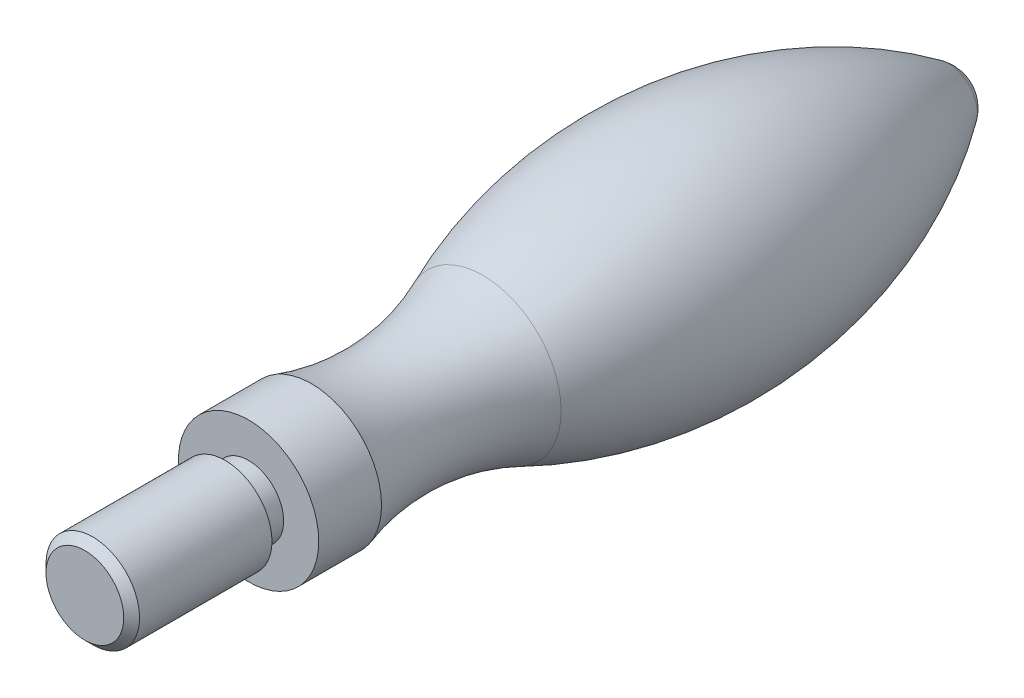
from build123d import *

# Parameters (mm, degrees)
SKETCH_1_R          = 4
EXTRUDE_1_DEPTH     = 14
SKETCH_2_OUTSIDE_W  = 13.6
SKETCH_2_OUTSIDE_H  = 13.6
SKETCH_2_OUTSIDE_R  = 3
CUT_EXTRUDE_1_DEPTH = 2


# Read off the part's stored shape, not the designer's step: M8 机械螺纹 螺柱1
with BuildPart() as part:
    # 草图1 → 凸台-拉伸1 (new body)
    with BuildSketch(Plane.XY):
        Circle(SKETCH_1_R)
    extrude(amount=-EXTRUDE_1_DEPTH)

    # 草图2 outside → 切除-拉伸1 (cut)
    with BuildSketch(Plane(origin=(0, 0, -14), x_dir=(-1, 0, 0), z_dir=(0, 0, -1))):
        Rectangle(SKETCH_2_OUTSIDE_W, SKETCH_2_OUTSIDE_H)
        Circle(SKETCH_2_OUTSIDE_R, mode=Mode.SUBTRACT)
    extrude(amount=-CUT_EXTRUDE_1_DEPTH, mode=Mode.SUBTRACT)

    # M8 机械螺纹 螺柱1 outline → M8 机械螺纹 螺柱1 (revolve, cut)
    with BuildSketch(Plane.XZ):
        Polygon((4, 0), (3.3235, 0), (4, -0.6765), align=None)
    revolve(axis=Axis((0, 0, 0), (0, 0, 1)), mode=Mode.SUBTRACT)

    # 草图4 one side → 旋转1 (revolve)
    with BuildSketch(Plane(origin=(0, 0, 0), x_dir=(0, 0, -1), z_dir=(1, 0, 0))):
        with BuildLine():
            Line((14, 6), (14, 0))
            Line((14, 0), (75.144445246, 0))
            ThreePointArc((75.144445246, 0), (74.809510044, 1.377472185), (73.879492165, 2.447368421))
            ThreePointArc((73.879492165, 2.447368421), (54.51207399, 9.769129661), (34.036579508, 6.693548387))
            ThreePointArc((34.036579508, 6.693548387), (26.766592165, 5.023444587), (19.371438197, 6))
            Line((19.371438197, 6), (14, 6))
        make_face()
    revolve(axis=Axis((0, 0, -14), (0, 0, -1)))


solid = part.part
